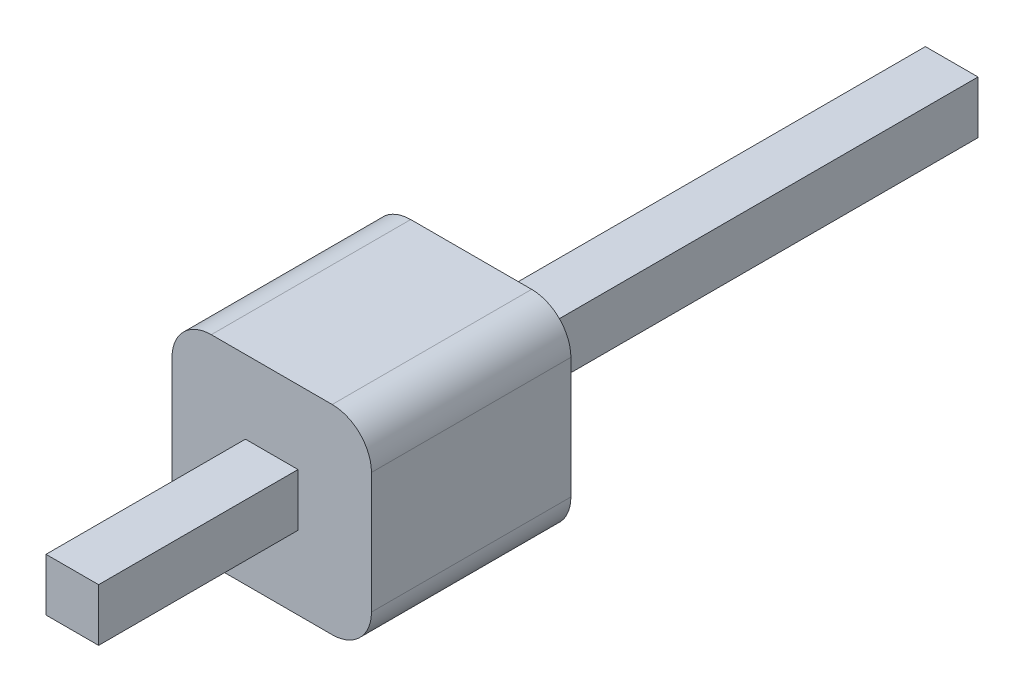
from build123d import *

# Parameters (mm, degrees)
SKETCH_1_W      = 2.54
SKETCH_1_H      = 2.54
EXTRUDE_1_DEPTH = 2.54
SKETCH_2_W      = 0.67
SKETCH_2_H      = 0.67
FILLET_1_R      = 0.5


with BuildPart() as part:
    # 草图1 → 拉伸1 (new body)
    with BuildSketch(Plane.XY):
        Rectangle(SKETCH_1_W, SKETCH_1_H)
    extrude(amount=EXTRUDE_1_DEPTH)

    # 扫描1: sweep along a path in 草图3
    with BuildLine(Plane(origin=(0, 0, 0), x_dir=(0, 0, -1), z_dir=(1, 0, 0))) as sweep_1_path:
        Line((6.12, -0.01), (-5.08, -0.01))
    # 草图2 → 扫描1 (sweep)
    with BuildSketch(Plane(origin=(0, 0, 5.08), x_dir=(-1, 0, 0), z_dir=(0, 0, -1))):
        Rectangle(SKETCH_2_W, SKETCH_2_H)
    sweep(path=sweep_1_path.line)

    # 圆角1
    fillet_1_edges = [part.edges().sort_by_distance(p)[0] for p in [
        (1.27, 1.27, 1.27),
        (1.27, -1.27, 1.27),
        (-1.27, -1.27, 1.27),
        (-1.27, 1.27, 1.27),
    ]]
    fillet(fillet_1_edges, radius=FILLET_1_R)


solid = part.part
